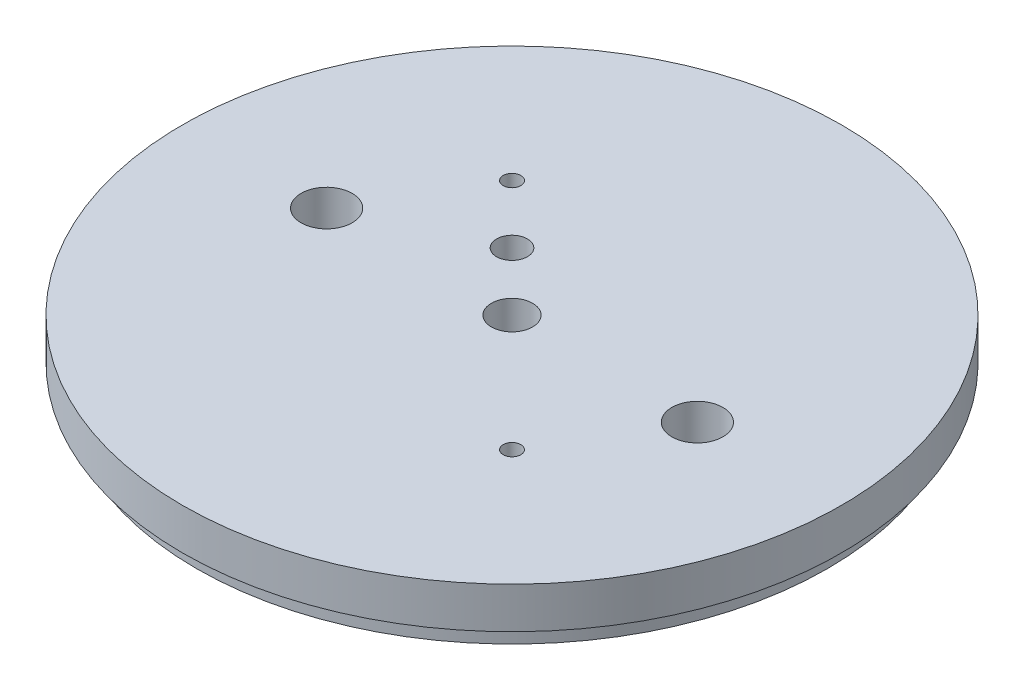
from build123d import *

# Parameters (mm, degrees)
SKETCH1_R           = 50.8
SKETCH1_R_2         = 3.175
SKETCH1_R_3         = 3.937
SKETCH1_R_4         = 1.3589
SKETCH1_R_5         = 2.38125
BOSS_EXTRUDE1_DEPTH = 9.525
SKETCH2_R           = 50.8
SKETCH2_R_2         = 48.641
CUT_EXTRUDE1_DEPTH  = 3.175
CUT_EXTRUDE2_START  = -5.969
CUT_EXTRUDE2_DEPTH  = 3.556


with BuildPart() as part:
    # Sketch1 → Boss-Extrude1 (new body)
    with BuildSketch(Plane(origin=(0, 0, 0), x_dir=(1, 0, 0), z_dir=(0, 1, 0))):
        Circle(SKETCH1_R)
        Circle(SKETCH1_R_2, mode=Mode.SUBTRACT)
        with Locations((28.575, 0)):
            Circle(SKETCH1_R_3, mode=Mode.SUBTRACT)
        with Locations((-28.575, 0)):
            Circle(SKETCH1_R_3, mode=Mode.SUBTRACT)
        with Locations((-17.960512242, 17.960512242)):
            Circle(SKETCH1_R_4, mode=Mode.SUBTRACT)
        with Locations((17.960512242, -17.960512242)):
            Circle(SKETCH1_R_4, mode=Mode.SUBTRACT)
        with Locations((-8.980256121, 8.980256121)):
            Circle(SKETCH1_R_5, mode=Mode.SUBTRACT)
    extrude(amount=BOSS_EXTRUDE1_DEPTH)

    # Sketch2 → Cut-Extrude1 (cut)
    with BuildSketch(Plane.XZ):
        Circle(SKETCH2_R)
        Circle(SKETCH2_R_2, mode=Mode.SUBTRACT)
    extrude(amount=-CUT_EXTRUDE1_DEPTH, mode=Mode.SUBTRACT)

    # Sketch3 → Cut-Extrude2 (cut)
    with BuildSketch(Plane(origin=(0, 9.525, 0), x_dir=(1, 0, 0), z_dir=(0, 1, 0)).offset(CUT_EXTRUDE2_START)):
        with BuildLine():
            Line((3.2385, 34.798), (3.2385, 13.97))
            ThreePointArc((3.2385, 13.97), (0, 10.7315), (-3.2385, 13.97))
            Line((-3.2385, 13.97), (-3.2385, 34.798))
            ThreePointArc((-3.2385, 34.798), (0, 38.0365), (3.2385, 34.798))
        make_face()
        with BuildLine():
            Line((3.2385, -34.798), (3.2385, -13.97))
            ThreePointArc((3.2385, -13.97), (0, -10.7315), (-3.2385, -13.97))
            Line((-3.2385, -13.97), (-3.2385, -34.798))
            ThreePointArc((-3.2385, -34.798), (0, -38.0365), (3.2385, -34.798))
        make_face()
    extrude(amount=-CUT_EXTRUDE2_DEPTH, mode=Mode.SUBTRACT)


solid = part.part
